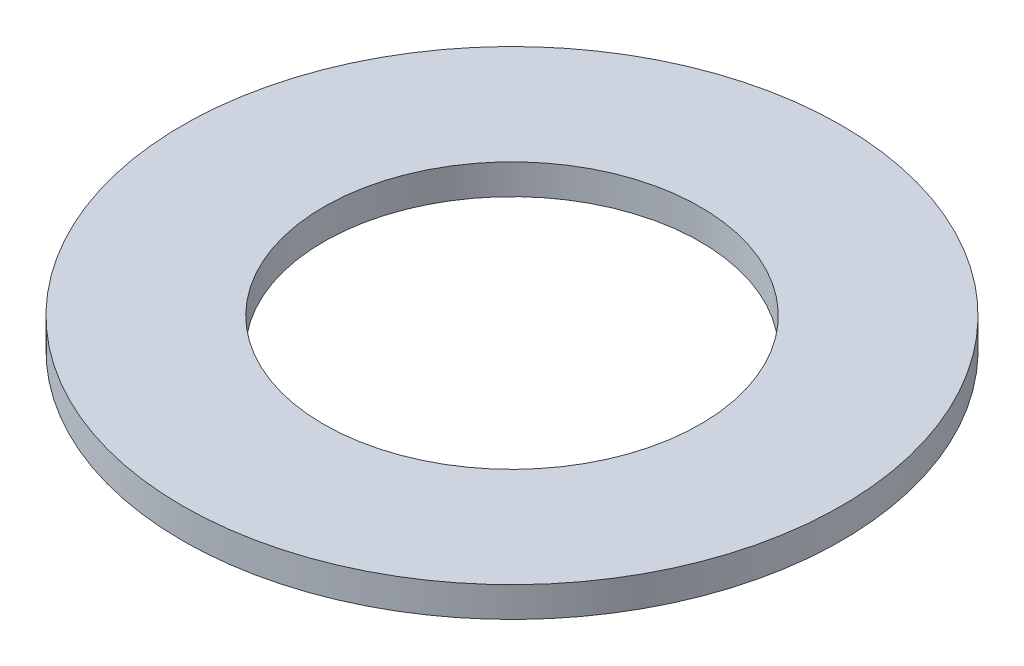
from build123d import *

# Parameters (mm, degrees)
SKETCH1_R           = 87.5
BOSS_EXTRUDE1_DEPTH = 8
SKETCH2_R           = 50
CUT_EXTRUDE1_DEPTH  = 125.002016113


with BuildPart() as part:
    # Sketch1 → Boss-Extrude1 (new body)
    with BuildSketch(Plane(origin=(0, 0, 0), x_dir=(1, 0, 0), z_dir=(0, 1, 0))):
        Circle(SKETCH1_R)
    extrude(amount=BOSS_EXTRUDE1_DEPTH)

    # Sketch2 → Cut-Extrude1 (cut, through all)
    with BuildSketch(Plane(origin=(0, 0, 0), x_dir=(1, 0, 0), z_dir=(0, 1, 0))):
        Circle(SKETCH2_R)
    extrude(amount=CUT_EXTRUDE1_DEPTH, mode=Mode.SUBTRACT)


solid = part.part
